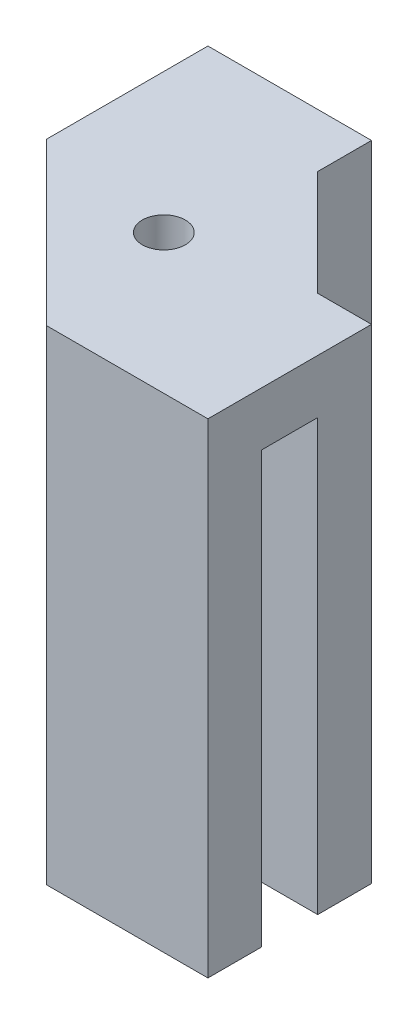
from build123d import *

# Parameters (mm, degrees)
BOSS_EXTRUDE1_DEPTH         = 50.8
TAP_DRILL_FOR_1_4_20_TAP1_D = 5.08
SKETCH4_R                   = 2.5399999999999947
BOSS_EXTRUDE2_DEPTH         = 6.35


with BuildPart() as part:
    # Sketch1 → Boss-Extrude1 (new body)
    with BuildSketch(Plane(origin=(0, 0, 0), x_dir=(1, 0, 0), z_dir=(0, 1, 0))):
        Polygon((22.098000000000056, 9.651999999999928), (9.652, 22.09800000000003), (9.652000000000001, 28.447999999999904), (3.3019999999999996, 28.447999999999904), (3.302000000000003, 15.747999999999971), (-3.3020000000000005, 15.747999999999967), (-3.3020000000000014, 28.447999999999904), (-9.652000000000001, 28.447999999999904), (-9.652000000000001, 9.39799999999991), (9.397999999999879, -9.652000000000031), (28.447999999999862, -9.652000000000092), (28.44799999999989, -3.3020000000001004), (15.747999999999957, -3.3020000000000556), (15.747999999999982, 3.3019999999999445), (28.447999999999915, 3.3019999999998992), (28.447999999999933, 9.65199999999991), align=None)
    extrude(amount=BOSS_EXTRUDE1_DEPTH)

    # Tap Drill for 1/4-20 Tap1 (through all)
    with Locations(Plane(origin=(0, 50.8, 0), x_dir=(1, 0, 0), z_dir=(0, 1, 0))):
        with Locations((6.795346667, 6.795346667)):
            Hole(TAP_DRILL_FOR_1_4_20_TAP1_D / 2)

    # Sketch4 → Boss-Extrude2 (add)
    with BuildSketch(Plane(origin=(0, 50.8, 0), x_dir=(1, 0, 0), z_dir=(0, 1, 0))):
        Polygon((-3.3020000000000014, 28.447999999999904), (3.3019999999999996, 28.447999999999904), (9.652000000000001, 28.447999999999904), (9.652, 22.09800000000003), (22.098000000000056, 9.651999999999928), (28.447999999999933, 9.65199999999991), (28.447999999999915, 3.3019999999998992), (28.44799999999989, -3.3020000000001004), (28.447999999999862, -9.652000000000092), (9.397999999999879, -9.652000000000031), (-9.652000000000001, 9.39799999999991), (-9.652000000000001, 28.447999999999904), align=None)
        with Locations((6.7953466666666715, 6.7953466666666476)):
            Circle(SKETCH4_R, mode=Mode.SUBTRACT)
    extrude(amount=BOSS_EXTRUDE2_DEPTH)


solid = part.part
